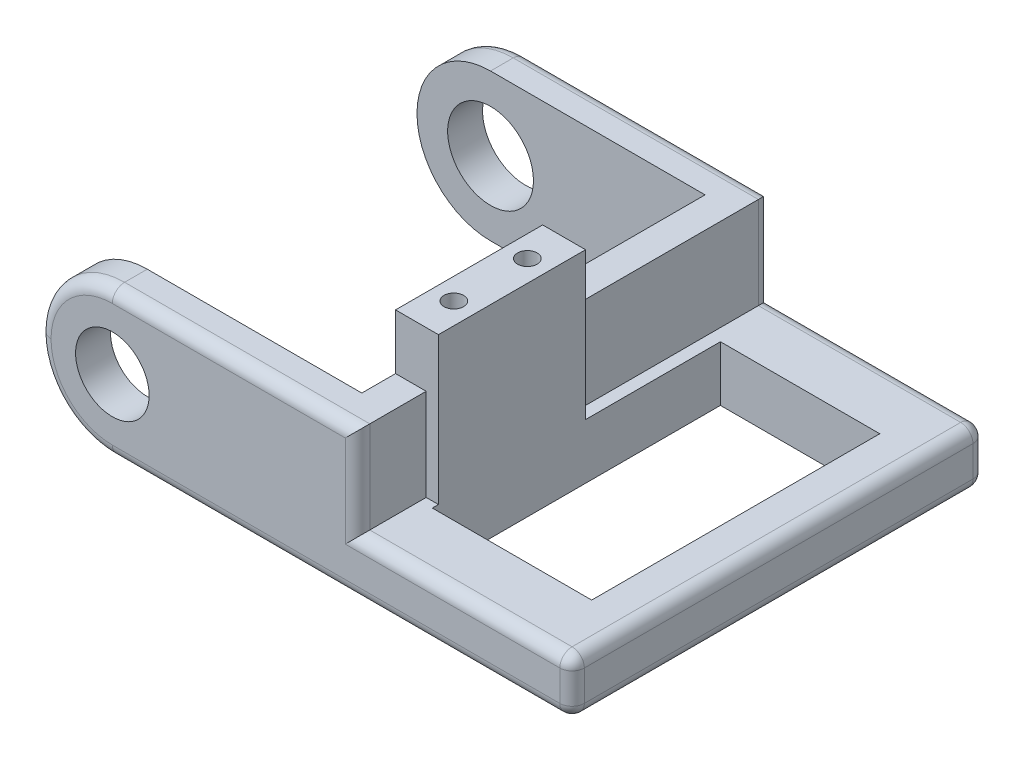
from build123d import *

# Parameters (mm, degrees)
SKETCH1_W           = 33.7
SKETCH1_H           = 12
BOSS_EXTRUDE1_DEPTH = 2.5
SKETCH2_W           = 33.7
SKETCH2_H           = 4.5
BOSS_EXTRUDE2_DEPTH = 17.5
SKETCH3_W           = 13
SKETCH3_H           = 23.5
CUT_EXTRUDE1_DEPTH  = 258.235074474
SKETCH4_W           = 2.85
SKETCH4_H           = 12
BOSS_EXTRUDE3_DEPTH = 23.5
FILLET1_R           = 6
SKETCH5_R           = 3
CUT_EXTRUDE2_DEPTH  = 4
SKETCH6_R           = 3.5
CUT_EXTRUDE3_DEPTH  = 4
SKETCH7_W           = 3.5
SKETCH7_H           = 12
BOSS_EXTRUDE4_DEPTH = 12
FILLET2_R           = 1
SKETCH8_R           = 0.800000001
CUT_EXTRUDE4_DEPTH  = 2


with BuildPart() as part:
    # Sketch1 → Boss-Extrude1 (new body)
    with BuildSketch(Plane(origin=(0, 0, 0), x_dir=(0, 0, -1), z_dir=(1, 0, 0))):
        with Locations((-239.496705732, 20.068965517)):
            Rectangle(SKETCH1_W, SKETCH1_H)
    extrude(amount=BOSS_EXTRUDE1_DEPTH)

    # Sketch2 → Boss-Extrude2 (add)
    with BuildSketch(Plane(origin=(2.5, 0, 0), x_dir=(0, 0, -1), z_dir=(1, 0, 0))):
        with Locations((-239.496705732, 16.318965517)):
            Rectangle(SKETCH2_W, SKETCH2_H)
    extrude(amount=BOSS_EXTRUDE2_DEPTH)

    # Sketch3 → Cut-Extrude1 (cut, through all)
    with BuildSketch(Plane(origin=(0, 18.568965517, 0), x_dir=(1, 0, 0), z_dir=(0, 1, 0))):
        with Locations((10, -239.496705732)):
            Rectangle(SKETCH3_W, SKETCH3_H)
    extrude(amount=-CUT_EXTRUDE1_DEPTH, mode=Mode.SUBTRACT)

    # Sketch4 → Boss-Extrude3 (add)
    with BuildSketch(Plane.ZY):
        with Locations((224.071705732, 20.068965517)):
            Rectangle(SKETCH4_W, SKETCH4_H)
        with Locations((254.921705732, 20.068965517)):
            Rectangle(SKETCH4_W, SKETCH4_H)
    extrude(amount=BOSS_EXTRUDE3_DEPTH)

    # Fillet1
    fillet1_edges = [part.edges().sort_by_distance(p)[0] for p in [
        (-23.5, 14.068965517, 224.071705732),
        (-23.5, 26.068965517, 224.071705732),
        (-23.5, 14.068965517, 254.921705732),
        (-23.5, 26.068965517, 254.921705732),
    ]]
    fillet(fillet1_edges, radius=FILLET1_R - 0.0001)  # a hair under: the kernel refuses the full size

    # Sketch5 → Cut-Extrude2 (cut)
    with BuildSketch(Plane.XY.offset(256.346705732)):
        with Locations((-17.5, 20.068965517)):
            Circle(SKETCH5_R)
    extrude(amount=-CUT_EXTRUDE2_DEPTH, mode=Mode.SUBTRACT)

    # Sketch6 → Cut-Extrude3 (cut)
    with BuildSketch(Plane.XY.offset(225.496705732)):
        with Locations((-17.5, 20.068965517)):
            Circle(SKETCH6_R)
    extrude(amount=-CUT_EXTRUDE3_DEPTH, mode=Mode.SUBTRACT)

    # Sketch7 → Boss-Extrude4 (add)
    with BuildSketch(Plane(origin=(0, 18.568965517, 0), x_dir=(1, 0, 0), z_dir=(0, 1, 0))):
        with Locations((1.75, -244.746705732)):
            Rectangle(SKETCH7_W, SKETCH7_H)
    extrude(amount=BOSS_EXTRUDE4_DEPTH)

    # Fillet2
    fillet2_edges = [part.edges().sort_by_distance(p)[0] for p in [
        (2.5, 22.318965517, 222.646705732),
        (11.25, 18.568965517, 256.346705732),
        (11.25, 18.568965517, 222.646705732),
        (20, 16.318965517, 256.346705732),
        (20, 14.068965517, 239.496705732),
        (20, 16.318965517, 222.646705732),
        (20, 18.568965517, 239.496705732),
        (2.5, 22.318965517, 256.346705732),
        (-21.742669976, 24.311635494, 222.646705732),
        (-21.742669976, 15.826295541, 222.646705732),
        (-21.742669976, 24.311635494, 256.346705732),
        (-21.742669976, 15.826295541, 256.346705732),
        (-7.50005, 26.068965517, 256.346705732),
        (-7.50005, 26.068965517, 222.646705732),
        (1.24995, 14.068965517, 222.646705732),
        (1.24995, 14.068965517, 256.346705732),
    ]]
    fillet(fillet2_edges, radius=FILLET2_R)

    # Sketch8 → Cut-Extrude4 (cut)
    with BuildSketch(Plane(origin=(0, 30.568965517, 0), x_dir=(1, 0, 0), z_dir=(0, 1, 0))):
        with Locations(Location((1.75, -247.746705734, 0), (0, 0, 270))):
            Circle(SKETCH8_R)
        with Locations(Location((1.75, -241.746705734, 0), (0, 0, 270))):
            Circle(SKETCH8_R)
    extrude(amount=-CUT_EXTRUDE4_DEPTH, mode=Mode.SUBTRACT)


solid = part.part
